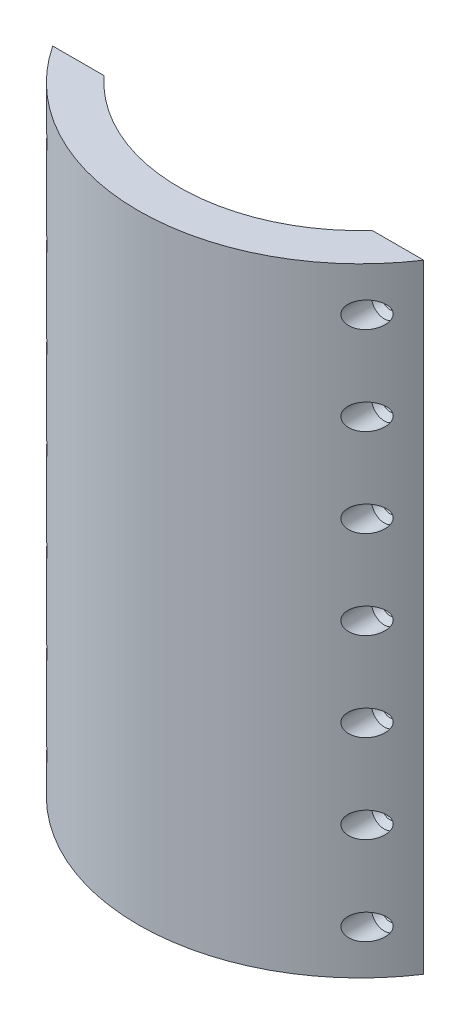
from build123d import *

# Parameters (mm, degrees)
BOSS_EXTRUDE1_DEPTH = 140
LPATTERN1_COUNT     = 7
LPATTERN1_PITCH     = 20


with BuildPart() as part:
    # Sketch1 → Boss-Extrude1 (new body)
    with BuildSketch(Plane(origin=(60.535204745, 0, -85.948449604), x_dir=(1, 0, 0), z_dir=(0, 1, 0))):
        with BuildLine():
            ThreePointArc((-30.186446753, -113.644462538), (-60.535204745, -127.035141416), (-90.883962736, -113.644462538))
            Line((-90.883962736, -113.644462538), (-102.513962844, -113.644462538))
            ThreePointArc((-102.513962844, -113.644462538), (-60.535204745, -136.240449604), (-18.556446645, -113.644462538))
            Line((-18.556446645, -113.644462538), (-30.186446753, -113.644462538))
        make_face()
    extrude(amount=BOSS_EXTRUDE1_DEPTH)

    # Sketch6 → Cut-Revolve4 (revolve, cut)
    with BuildSketch(Plane(origin=(36.163758045, 10, 27.696012934), x_dir=(-1, 0, 0), z_dir=(0, -1, 0))):
        Polygon((0, 1.685394277), (0, -4.78184701), (0, -15.185924704), (-2.9, -15.185924704), (-2.9, -3.079025683), (-1.65, -1.881964943), (-1.65, 1.685394277), align=None)
    cut_revolve4 = revolve(axis=Axis((36.163758045, 10, 26.010618657), (0, 0, 1)), mode=Mode.SUBTRACT)

    # LPattern1: Cut-Revolve4 ×7
    with Locations(*[(0, i * LPATTERN1_PITCH, 0) for i in range(1, LPATTERN1_COUNT)]):
        add(cut_revolve4, mode=Mode.SUBTRACT)

    # Mirror1: Cut-Revolve4 across plane
    add(cut_revolve4.mirror(Plane(origin=(0, 0, 0), x_dir=(0, 0, 1), z_dir=(1, 0, 0))), mode=Mode.SUBTRACT)

    # Mirror1 copy 1 sketch → Mirror1 copy 1 (revolve, cut)
    with BuildSketch(Plane(origin=(-36.163758045, 30, 27.696012934), x_dir=(1, 0, 0), z_dir=(0, -1, 0))):
        Polygon((0, -1.685394277), (0, 4.78184701), (0, 15.185924704), (-2.9, 15.185924704), (-2.9, 3.079025683), (-1.65, 1.881964943), (-1.65, -1.685394277), align=None)
    revolve(axis=Axis((-36.163758045, 30, 26.010618657), (0, 0, -1)), mode=Mode.SUBTRACT)

    # Mirror1 copy 2 sketch → Mirror1 copy 2 (revolve, cut)
    with BuildSketch(Plane(origin=(-36.163758045, 50, 27.696012934), x_dir=(1, 0, 0), z_dir=(0, -1, 0))):
        Polygon((0, -1.685394277), (0, 4.78184701), (0, 15.185924704), (-2.9, 15.185924704), (-2.9, 3.079025683), (-1.65, 1.881964943), (-1.65, -1.685394277), align=None)
    revolve(axis=Axis((-36.163758045, 50, 26.010618657), (0, 0, -1)), mode=Mode.SUBTRACT)

    # Mirror1 copy 3 sketch → Mirror1 copy 3 (revolve, cut)
    with BuildSketch(Plane(origin=(-36.163758045, 70, 27.696012934), x_dir=(1, 0, 0), z_dir=(0, -1, 0))):
        Polygon((0, -1.685394277), (0, 4.78184701), (0, 15.185924704), (-2.9, 15.185924704), (-2.9, 3.079025683), (-1.65, 1.881964943), (-1.65, -1.685394277), align=None)
    revolve(axis=Axis((-36.163758045, 70, 26.010618657), (0, 0, -1)), mode=Mode.SUBTRACT)

    # Mirror1 copy 4 sketch → Mirror1 copy 4 (revolve, cut)
    with BuildSketch(Plane(origin=(-36.163758045, 90, 27.696012934), x_dir=(1, 0, 0), z_dir=(0, -1, 0))):
        Polygon((0, -1.685394277), (0, 4.78184701), (0, 15.185924704), (-2.9, 15.185924704), (-2.9, 3.079025683), (-1.65, 1.881964943), (-1.65, -1.685394277), align=None)
    revolve(axis=Axis((-36.163758045, 90, 26.010618657), (0, 0, -1)), mode=Mode.SUBTRACT)

    # Mirror1 copy 5 sketch → Mirror1 copy 5 (revolve, cut)
    with BuildSketch(Plane(origin=(-36.163758045, 110, 27.696012934), x_dir=(1, 0, 0), z_dir=(0, -1, 0))):
        Polygon((0, -1.685394277), (0, 4.78184701), (0, 15.185924704), (-2.9, 15.185924704), (-2.9, 3.079025683), (-1.65, 1.881964943), (-1.65, -1.685394277), align=None)
    revolve(axis=Axis((-36.163758045, 110, 26.010618657), (0, 0, -1)), mode=Mode.SUBTRACT)

    # Mirror1 copy 6 sketch → Mirror1 copy 6 (revolve, cut)
    with BuildSketch(Plane(origin=(-36.163758045, 130, 27.696012934), x_dir=(1, 0, 0), z_dir=(0, -1, 0))):
        Polygon((0, -1.685394277), (0, 4.78184701), (0, 15.185924704), (-2.9, 15.185924704), (-2.9, 3.079025683), (-1.65, 1.881964943), (-1.65, -1.685394277), align=None)
    revolve(axis=Axis((-36.163758045, 130, 26.010618657), (0, 0, -1)), mode=Mode.SUBTRACT)


solid = part.part
